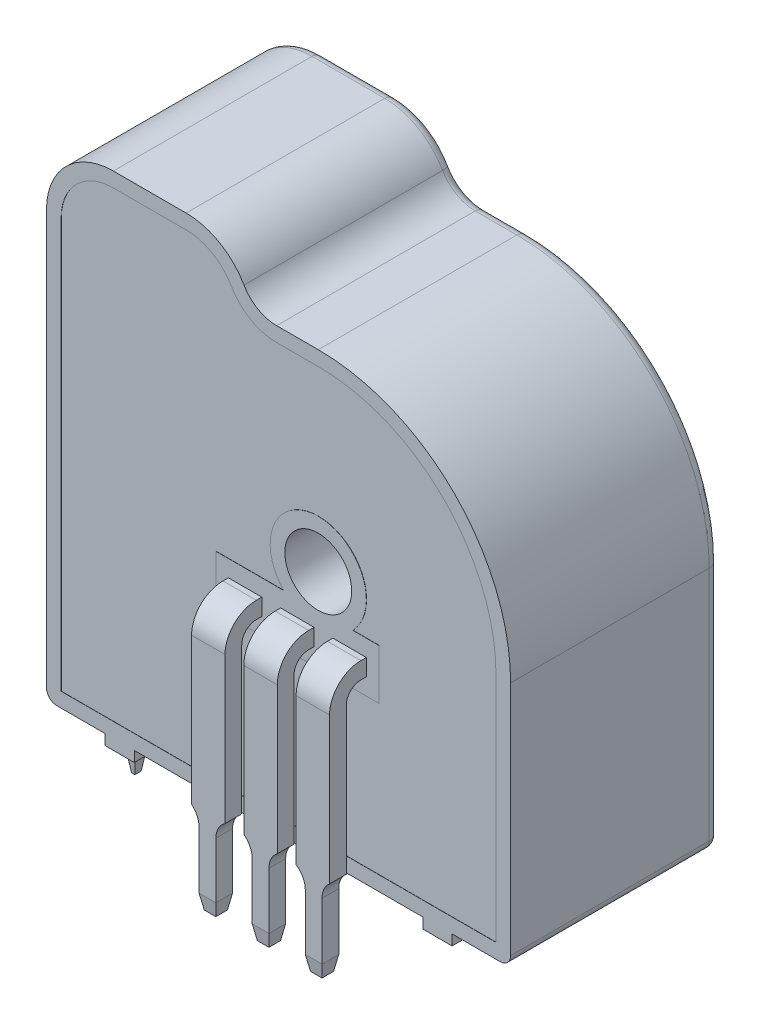
from build123d import *

# Parameters (mm, degrees)
SKETCH1_R                      = 1.6
BOSS_EXTRUDE1_DEPTH            = 10
FILLET1_R                      = 9.2
FILLET2_R                      = 3.2
FILLET3_R                      = 1.8
FILLET4_R                      = 0.5
CUT_EXTRUDE1_DEPTH             = 0.01
BOSS_EXTRUDE2_DEPTH            = 0.26
BOSS_EXTRUDE2_DEPTH_BACK       = 10.24
SKETCH8_W                      = 1.6
SKETCH8_H                      = 0.8
SKETCH9_W                      = 1.6
SKETCH9_H                      = 0.8
SKETCH12_W                     = 1.6
SKETCH12_H                     = 0.8
BOSS_EXTRUDE3_DEPTH            = 7
SKETCH13_W                     = 1.6
SKETCH13_H                     = 0.8
SKETCH16_W                     = 1.6
SKETCH16_H                     = 0.8
BOSS_EXTRUDE5_DEPTH            = 7
SKETCH17_W                     = 0.8
SKETCH17_H                     = 0.8
BOSS_EXTRUDE6_DEPTH            = 3.5
SKETCH18_W                     = 0.8
SKETCH18_H                     = 0.8
BOSS_EXTRUDE7_DEPTH            = 0.7
BOSS_EXTRUDE7_DRAFT            = 10
BOSS_EXTRUDE7_PROFILE_2_DEPTH  = 0.7
BOSS_EXTRUDE7_PROFILE_2_DRAFT  = 10
BOSS_EXTRUDE7_PROFILE_3_DEPTH  = 0.7
BOSS_EXTRUDE7_PROFILE_3_DRAFT  = 10
BOSS_EXTRUDE7_PROFILE_4_DEPTH  = 0.7
BOSS_EXTRUDE7_PROFILE_4_DRAFT  = 10
BOSS_EXTRUDE7_PROFILE_5_DEPTH  = 0.7
BOSS_EXTRUDE7_PROFILE_5_DRAFT  = 10
BOSS_EXTRUDE7_PROFILE_6_DEPTH  = 0.7
BOSS_EXTRUDE7_PROFILE_6_DRAFT  = 10
FILLET5_R                      = 1
SKETCH22_W                     = 1.4
SKETCH22_H                     = 9.5
BOSS_EXTRUDE8_DEPTH            = 0.5
SKETCH23_W                     = 0.35
SKETCH23_H                     = 0.5
BOSS_EXTRUDE9_DEPTH            = 2.6
SKETCH24_W                     = 0.35
SKETCH24_H                     = 0.5
BOSS_EXTRUDE10_DEPTH           = 0.7
BOSS_EXTRUDE10_DRAFT           = 8
BOSS_EXTRUDE10_PROFILE_2_DEPTH = 0.7
BOSS_EXTRUDE10_PROFILE_2_DRAFT = 8
BOSS_EXTRUDE10_PROFILE_3_DEPTH = 0.7
BOSS_EXTRUDE10_PROFILE_3_DRAFT = 8
BOSS_EXTRUDE11_DEPTH           = 0.05
CUT_EXTRUDE2_DEPTH             = 0.1
CUT_EXTRUDE3_DEPTH             = 0.1


with BuildPart() as part:
    # Sketch1 → Boss-Extrude1 (new body)
    with BuildSketch(Plane.XY):
        Polygon((0, 0), (22.2, 0), (22.2, 21), (9.8, 21), (9.8, 23.5), (0, 23.5), align=None)
        with Locations((13, 11.8)):
            Circle(SKETCH1_R, mode=Mode.SUBTRACT)
    extrude(amount=BOSS_EXTRUDE1_DEPTH)

    # Fillet1
    fillet1_edges = [part.edges().sort_by_distance(p)[0] for p in [
        (22.2, 21, 5),
    ]]
    fillet(fillet1_edges, radius=FILLET1_R)

    # Fillet2
    # the kernel refuses this fillet: 3.2 mm, written as the material it takes off along each edge
    with BuildSketch(Plane(origin=(9.8, 23.5, -7.806247498), x_dir=(0, -1, 0), z_dir=(0, 0, 1))) as fillet2_piece_1:
        with BuildLine():
            CenterArc((3.2, -3.122498999), FILLET2_R, 102.635625093, 77.364374907)
            Line((0, -3.122498999), (-0.064, -3.122498999))
            Line((-0.064, -3.122498999), (-0.064, 0))
            Line((-0.064, 0), (0, 0.064))
            ThreePointArc((0, 0.064), (1.25, 0.064), (2.486, 0.06244998))
            Line((2.486, 0.06244998), (2.5, 0))
        make_face()
    extrude(amount=25.612494996, mode=Mode.SUBTRACT)
    with BuildSketch(Plane(origin=(0, 23.5, -8), x_dir=(0, -1, 0), z_dir=(0, 0, 1))) as fillet2_piece_2:
        with BuildLine():
            CenterArc((FILLET2_R, FILLET2_R), FILLET2_R, 180, 90)
            Line((0, FILLET2_R), (-FILLET2_R * 0.02, FILLET2_R))
            Line((-FILLET2_R * 0.02, FILLET2_R), (-FILLET2_R * 0.02, -FILLET2_R * 0.02))
            Line((-FILLET2_R * 0.02, -FILLET2_R * 0.02), (FILLET2_R, -FILLET2_R * 0.02))
            Line((FILLET2_R, -FILLET2_R * 0.02), (FILLET2_R, 0))
        make_face()
    extrude(amount=26, mode=Mode.SUBTRACT)

    # Fillet3
    fillet3_edges = [part.edges().sort_by_distance(p)[0] for p in [
        (9.8, 21, 5),
    ]]
    fillet(fillet3_edges, radius=FILLET3_R)

    # Fillet4
    fillet4_edges = [part.edges().sort_by_distance(p)[0] for p in [
        (22.2, 0, 5),
        (0, 0, 5),
        (12.00381401, 21, 0),
        (19.505382387, 18.305382387, 0),
        (4.9387505, 23.5, 0),
        (0, 10.15, 0),
        (0.9372583, 22.5627417, 0),
        (8.277501001, 23.071281292, 0),
        (10.10762802, 21.241154273, 0),
        (22.2, 5.9, 0),
        (11.1, 0, 0),
    ]]
    fillet(fillet4_edges, radius=FILLET4_R)

    # Sketch4 → Cut-Extrude1 (cut)
    with BuildSketch(Plane.XY.offset(10)):
        with BuildLine():
            Line((0.7, 0.7), (21.5, 0.7))
            Line((21.5, 0.7), (21.5, 11.8))
            ThreePointArc((21.5, 11.8), (19.01040764, 17.81040764), (13, 20.3))
            Line((13, 20.3), (11.00762802, 20.3))
            ThreePointArc((11.00762802, 20.3), (9.75762802, 20.634936491), (8.84256451, 21.55))
            ThreePointArc((8.84256451, 21.55), (7.927501001, 22.465063509), (6.677501001, 22.8))
            Line((6.677501001, 22.8), (3.2, 22.8))
            ThreePointArc((3.2, 22.8), (1.432233047, 22.067766953), (0.7, 20.3))
            Line((0.7, 20.3), (0.7, 0.7))
        make_face()
        with BuildLine():
            Line((8.1, 7.8), (15.9, 7.8))
            Line((15.9, 7.8), (15.9, 10.2))
            Line((15.9, 10.2), (14.652271164, 10.2))
            ThreePointArc((14.652271164, 10.2), (13, 14.1), (11.347728836, 10.2))
            Line((11.347728836, 10.2), (8.1, 10.2))
            Line((8.1, 10.2), (8.1, 7.8))
        make_face(mode=Mode.SUBTRACT)
    extrude(amount=-CUT_EXTRUDE1_DEPTH, mode=Mode.SUBTRACT)

    # Sketch8 → Boss-Extrude2 (add, two sides: drawn at the far end of the back side and taken through both)
    with BuildSketch(Plane.XY.offset(10).offset(-BOSS_EXTRUDE2_DEPTH_BACK)):
        with Locations((9.5, 9)):
            Rectangle(SKETCH8_W, SKETCH8_H)
        with Locations((12, 9)):
            Rectangle(SKETCH8_W, SKETCH8_H)
        with Locations((14.5, 9)):
            Rectangle(SKETCH8_W, SKETCH8_H)
    extrude(amount=BOSS_EXTRUDE2_DEPTH + BOSS_EXTRUDE2_DEPTH_BACK)

    # Sweep4: sweep along a path in Sketch11
    with BuildLine(Plane(origin=(12, 0, 0), x_dir=(0, 0, -1), z_dir=(1, 0, 0))) as sweep4_path:
        ThreePointArc((-10.26, 9), (-11.037817459, 8.677817459), (-11.36, 7.9))
    # Sketch9 → Sweep4 (sweep)
    with BuildSketch(Plane.XY.offset(10.26)):
        with Locations((12, 9)):
            Rectangle(SKETCH9_W, SKETCH9_H)
        with Locations((14.5, 9)):
            Rectangle(SKETCH9_W, SKETCH9_H)
        with Locations((9.5, 9)):
            Rectangle(SKETCH9_W, SKETCH9_H)
    sweep(path=sweep4_path.line)

    # Sketch12 → Boss-Extrude3 (add)
    with BuildSketch(Plane.XZ.offset(-7.9)):
        with Locations((12, 11.36)):
            Rectangle(SKETCH12_W, SKETCH12_H)
        with Locations((14.5, 11.36)):
            Rectangle(SKETCH12_W, SKETCH12_H)
        with Locations((9.5, 11.36)):
            Rectangle(SKETCH12_W, SKETCH12_H)
    extrude(amount=BOSS_EXTRUDE3_DEPTH)

    # Sweep5: sweep along a path in Sketch14
    with BuildLine(Plane(origin=(12, 0, 0), x_dir=(0, 0, -1), z_dir=(1, 0, 0))) as sweep5_path:
        ThreePointArc((0.24, 9), (1.017817459, 8.677817459), (1.34, 7.9))
    # Sketch13 → Sweep5 (sweep)
    with BuildSketch(Plane(origin=(0, 0, -0.24), x_dir=(-1, 0, 0), z_dir=(0, 0, -1))):
        with Locations((-14.5, 9)):
            Rectangle(SKETCH13_W, SKETCH13_H)
        with Locations((-9.5, 9)):
            Rectangle(SKETCH13_W, SKETCH13_H)
        with Locations((-12, 9)):
            Rectangle(SKETCH13_W, SKETCH13_H)
    sweep(path=sweep5_path.line)

    # Sketch16 → Boss-Extrude5 (add)
    with BuildSketch(Plane.XZ.offset(-7.9)):
        with Locations((12, -1.34)):
            Rectangle(SKETCH16_W, SKETCH16_H)
        with Locations((14.5, -1.34)):
            Rectangle(SKETCH16_W, SKETCH16_H)
        with Locations((9.5, -1.34)):
            Rectangle(SKETCH16_W, SKETCH16_H)
    extrude(amount=BOSS_EXTRUDE5_DEPTH)

    # Sketch17 → Boss-Extrude6 (add)
    with BuildSketch(Plane.XZ.offset(-0.9)):
        with Locations((12, -1.34)):
            Rectangle(SKETCH17_W, SKETCH17_H)
        with Locations((14.54, -1.34)):
            Rectangle(SKETCH17_W, SKETCH17_H)
        with Locations((9.46, -1.34)):
            Rectangle(SKETCH17_W, SKETCH17_H)
        with Locations((14.54, 11.36)):
            Rectangle(SKETCH17_W, SKETCH17_H)
        with Locations((12, 11.36)):
            Rectangle(SKETCH17_W, SKETCH17_H)
        with Locations((9.46, 11.36)):
            Rectangle(SKETCH17_W, SKETCH17_H)
    extrude(amount=BOSS_EXTRUDE6_DEPTH)


with BuildPart() as boss_extrude7_tool:
    # Sketch18 → Boss-Extrude7 (with draft: the straight prism first)
    with BuildSketch(Plane.XZ.offset(2.6)):
        with Locations((12, 11.36)):
            Rectangle(SKETCH18_W, SKETCH18_H)
    extrude(amount=BOSS_EXTRUDE7_DEPTH)
    # Boss-Extrude7: the draft: its side faces are tilted about the plane it starts from
    boss_extrude7_sides = [boss_extrude7_tool.faces().sort_by_distance(p)[0] for p in [
        (12, -2.95, 11.76),
        (11.6, -2.95, 11.36),
        (12, -2.95, 10.96),
        (12.4, -2.95, 11.36),
    ]]
    draft(boss_extrude7_sides, Plane.XZ.offset(2.6), BOSS_EXTRUDE7_DRAFT)


with BuildPart() as part_1:
    add(part.part)

    # Boss-Extrude7: add boss_extrude7_tool
    add(boss_extrude7_tool.part)


with BuildPart() as boss_extrude7_profile_2_tool:
    # Sketch18 → Boss-Extrude7 profile 2 (with draft: the straight prism first)
    with BuildSketch(Plane.XZ.offset(2.6)):
        with Locations((14.54, 11.36)):
            Rectangle(SKETCH18_W, SKETCH18_H)
    extrude(amount=BOSS_EXTRUDE7_PROFILE_2_DEPTH)
    # Boss-Extrude7 profile 2: the draft: its side faces are tilted about the plane it starts from
    boss_extrude7_profile_2_sides = [boss_extrude7_profile_2_tool.faces().sort_by_distance(p)[0] for p in [
        (14.54, -2.95, 10.96),
        (14.94, -2.95, 11.36),
        (14.54, -2.95, 11.76),
        (14.14, -2.95, 11.36),
    ]]
    draft(boss_extrude7_profile_2_sides, Plane.XZ.offset(2.6), BOSS_EXTRUDE7_PROFILE_2_DRAFT)


with BuildPart() as part_2:
    add(part_1.part)

    # Boss-Extrude7 profile 2: add boss_extrude7_profile_2_tool
    add(boss_extrude7_profile_2_tool.part)


with BuildPart() as boss_extrude7_profile_3_tool:
    # Sketch18 → Boss-Extrude7 profile 3 (with draft: the straight prism first)
    with BuildSketch(Plane.XZ.offset(2.6)):
        with Locations((9.46, 11.36)):
            Rectangle(SKETCH18_W, SKETCH18_H)
    extrude(amount=BOSS_EXTRUDE7_PROFILE_3_DEPTH)
    # Boss-Extrude7 profile 3: the draft: its side faces are tilted about the plane it starts from
    boss_extrude7_profile_3_sides = [boss_extrude7_profile_3_tool.faces().sort_by_distance(p)[0] for p in [
        (9.46, -2.95, 10.96),
        (9.86, -2.95, 11.36),
        (9.46, -2.95, 11.76),
        (9.06, -2.95, 11.36),
    ]]
    draft(boss_extrude7_profile_3_sides, Plane.XZ.offset(2.6), BOSS_EXTRUDE7_PROFILE_3_DRAFT)


with BuildPart() as part_3:
    add(part_2.part)

    # Boss-Extrude7 profile 3: add boss_extrude7_profile_3_tool
    add(boss_extrude7_profile_3_tool.part)


with BuildPart() as boss_extrude7_profile_4_tool:
    # Sketch18 → Boss-Extrude7 profile 4 (with draft: the straight prism first)
    with BuildSketch(Plane.XZ.offset(2.6)):
        with Locations((14.54, -1.34)):
            Rectangle(SKETCH18_W, SKETCH18_H)
    extrude(amount=BOSS_EXTRUDE7_PROFILE_4_DEPTH)
    # Boss-Extrude7 profile 4: the draft: its side faces are tilted about the plane it starts from
    boss_extrude7_profile_4_sides = [boss_extrude7_profile_4_tool.faces().sort_by_distance(p)[0] for p in [
        (14.54, -2.95, -1.74),
        (14.94, -2.95, -1.34),
        (14.54, -2.95, -0.94),
        (14.14, -2.95, -1.34),
    ]]
    draft(boss_extrude7_profile_4_sides, Plane.XZ.offset(2.6), BOSS_EXTRUDE7_PROFILE_4_DRAFT)


with BuildPart() as part_4:
    add(part_3.part)

    # Boss-Extrude7 profile 4: add boss_extrude7_profile_4_tool
    add(boss_extrude7_profile_4_tool.part)


with BuildPart() as boss_extrude7_profile_5_tool:
    # Sketch18 → Boss-Extrude7 profile 5 (with draft: the straight prism first)
    with BuildSketch(Plane.XZ.offset(2.6)):
        with Locations((12, -1.34)):
            Rectangle(SKETCH18_W, SKETCH18_H)
    extrude(amount=BOSS_EXTRUDE7_PROFILE_5_DEPTH)
    # Boss-Extrude7 profile 5: the draft: its side faces are tilted about the plane it starts from
    boss_extrude7_profile_5_sides = [boss_extrude7_profile_5_tool.faces().sort_by_distance(p)[0] for p in [
        (12, -2.95, -0.94),
        (11.6, -2.95, -1.34),
        (12, -2.95, -1.74),
        (12.4, -2.95, -1.34),
    ]]
    draft(boss_extrude7_profile_5_sides, Plane.XZ.offset(2.6), BOSS_EXTRUDE7_PROFILE_5_DRAFT)


with BuildPart() as part_5:
    add(part_4.part)

    # Boss-Extrude7 profile 5: add boss_extrude7_profile_5_tool
    add(boss_extrude7_profile_5_tool.part)


with BuildPart() as boss_extrude7_profile_6_tool:
    # Sketch18 → Boss-Extrude7 profile 6 (with draft: the straight prism first)
    with BuildSketch(Plane.XZ.offset(2.6)):
        with Locations((9.46, -1.34)):
            Rectangle(SKETCH18_W, SKETCH18_H)
    extrude(amount=BOSS_EXTRUDE7_PROFILE_6_DEPTH)
    # Boss-Extrude7 profile 6: the draft: its side faces are tilted about the plane it starts from
    boss_extrude7_profile_6_sides = [boss_extrude7_profile_6_tool.faces().sort_by_distance(p)[0] for p in [
        (9.46, -2.95, -0.94),
        (9.06, -2.95, -1.34),
        (9.46, -2.95, -1.74),
        (9.86, -2.95, -1.34),
    ]]
    draft(boss_extrude7_profile_6_sides, Plane.XZ.offset(2.6), BOSS_EXTRUDE7_PROFILE_6_DRAFT)


with BuildPart() as part_6:
    add(part_5.part)

    # Boss-Extrude7 profile 6: add boss_extrude7_profile_6_tool
    add(boss_extrude7_profile_6_tool.part)

    # Fillet5
    # the kernel refuses this fillet: 1 mm, written as the material it adds along each edge
    with BuildSketch(Plane(origin=(9.06, 0.9, -1.74), x_dir=(-1, 0, 0), z_dir=(0, 0, 1)), Plane(origin=(9.06, 0.9, 10.96), x_dir=(-1, 0, 0), z_dir=(0, 0, 1))) as fillet5_piece_1:
        with BuildLine():
            CenterArc((1, 0.768374908), FILLET5_R, 180, 50.2081805)
            Line((0, 0.768374908), (0, 0))
            Line((0, 0), (0.36, 0))
        make_face()
    extrude(amount=0.8)
    with BuildSketch(Plane(origin=(9.86, 0.9, -0.94), x_dir=(1.0, -2.749568249844972e-12, 0), z_dir=(0, 0, -1)), Plane(origin=(9.86, 0.9, 11.76), x_dir=(1.0, -2.7478019859421624e-12, 0), z_dir=(0, 0, -1))) as fillet5_piece_2:
        with BuildLine():
            CenterArc((1, 0.828492607), FILLET5_R, 180, 55.944202257)
            Line((0, 0.828492607), (0, 0))
            Line((0, 0), (0.44, 0))
        make_face()
    extrude(amount=0.8)
    with BuildSketch(Plane(origin=(11.6, 0.9, -1.74), x_dir=(-1, 0, 0), z_dir=(0, 0, 1)), Plane(origin=(12.4, 0.9, -0.94), x_dir=(1, 0, 0), z_dir=(0, 0, -1)), Plane(origin=(12.4, 0.9, 11.76), x_dir=(1, 0, 0), z_dir=(0, 0, -1)), Plane(origin=(11.6, 0.9, 10.96), x_dir=(-1, 0, 0), z_dir=(0, 0, 1))) as fillet5_piece_3:
        with BuildLine():
            CenterArc((1, 0.8), FILLET5_R, 180, 53.130102354)
            Line((0, 0.8), (0, 0))
            Line((0, 0), (0.4, 0))
        make_face()
    extrude(amount=0.8)
    with BuildSketch(Plane(origin=(14.14, 0.9, -0.94), x_dir=(-1.0, -2.749568249844961e-12, 0), z_dir=(0, 0, -1)), Plane(origin=(14.14, 0.9, 11.76), x_dir=(-1.0, -2.7478019859421624e-12, 0), z_dir=(0, 0, -1))) as fillet5_piece_4:
        with BuildLine():
            CenterArc((1, -0.828492607), FILLET5_R, 124.055797743, 55.944202257)
            Line((0, -0.828492607), (0, 0))
            Line((0, 0), (0.44, 0))
        make_face()
    extrude(amount=0.8)
    with BuildSketch(Plane(origin=(14.94, 0.9, -1.74), x_dir=(1, 0, 0), z_dir=(0, 0, 1)), Plane(origin=(14.94, 0.9, 10.96), x_dir=(1, 0, 0), z_dir=(0, 0, 1))) as fillet5_piece_5:
        with BuildLine():
            CenterArc((1, -0.768374908), FILLET5_R, 129.7918195, 50.2081805)
            Line((0, -0.768374908), (0, 0))
            Line((0, 0), (0.36, 0))
        make_face()
    extrude(amount=0.8)

    # Sketch22 → Boss-Extrude8 (add)
    with BuildSketch(Plane.XZ):
        with Locations((3.5, 5.25)):
            Rectangle(SKETCH22_W, SKETCH22_H)
        with Locations((18.7, 5.25)):
            Rectangle(SKETCH22_W, SKETCH22_H)
    extrude(amount=BOSS_EXTRUDE8_DEPTH)

    # Sketch23 → Boss-Extrude9 (add)
    with BuildSketch(Plane.XZ):
        with Locations((1.84, 5)):
            Rectangle(SKETCH23_W, SKETCH23_H)
        with Locations((1.84, 7.54)):
            Rectangle(SKETCH23_W, SKETCH23_H)
        with Locations((1.84, 2.46)):
            Rectangle(SKETCH23_W, SKETCH23_H)
    extrude(amount=BOSS_EXTRUDE9_DEPTH)


with BuildPart() as boss_extrude10_tool:
    # Sketch24 → Boss-Extrude10 (with draft: the straight prism first)
    with BuildSketch(Plane.XZ.offset(2.6)):
        with Locations((1.84, 5)):
            Rectangle(SKETCH24_W, SKETCH24_H)
    extrude(amount=BOSS_EXTRUDE10_DEPTH)
    # Boss-Extrude10: the draft: its side faces are tilted about the plane it starts from
    boss_extrude10_sides = [boss_extrude10_tool.faces().sort_by_distance(p)[0] for p in [
        (1.665, -2.95, 5),
        (1.84, -2.95, 4.75),
        (2.015, -2.95, 5),
        (1.84, -2.95, 5.25),
    ]]
    draft(boss_extrude10_sides, Plane.XZ.offset(2.6), BOSS_EXTRUDE10_DRAFT)


with BuildPart() as part_7:
    add(part_6.part)

    # Boss-Extrude10: add boss_extrude10_tool
    add(boss_extrude10_tool.part)


with BuildPart() as boss_extrude10_profile_2_tool:
    # Sketch24 → Boss-Extrude10 profile 2 (with draft: the straight prism first)
    with BuildSketch(Plane.XZ.offset(2.6)):
        with Locations((1.84, 7.54)):
            Rectangle(SKETCH24_W, SKETCH24_H)
    extrude(amount=BOSS_EXTRUDE10_PROFILE_2_DEPTH)
    # Boss-Extrude10 profile 2: the draft: its side faces are tilted about the plane it starts from
    boss_extrude10_profile_2_sides = [boss_extrude10_profile_2_tool.faces().sort_by_distance(p)[0] for p in [
        (1.665, -2.95, 7.54),
        (1.84, -2.95, 7.29),
        (2.015, -2.95, 7.54),
        (1.84, -2.95, 7.79),
    ]]
    draft(boss_extrude10_profile_2_sides, Plane.XZ.offset(2.6), BOSS_EXTRUDE10_PROFILE_2_DRAFT)


with BuildPart() as part_8:
    add(part_7.part)

    # Boss-Extrude10 profile 2: add boss_extrude10_profile_2_tool
    add(boss_extrude10_profile_2_tool.part)


with BuildPart() as boss_extrude10_profile_3_tool:
    # Sketch24 → Boss-Extrude10 profile 3 (with draft: the straight prism first)
    with BuildSketch(Plane.XZ.offset(2.6)):
        with Locations((1.84, 2.46)):
            Rectangle(SKETCH24_W, SKETCH24_H)
    extrude(amount=BOSS_EXTRUDE10_PROFILE_3_DEPTH)
    # Boss-Extrude10 profile 3: the draft: its side faces are tilted about the plane it starts from
    boss_extrude10_profile_3_sides = [boss_extrude10_profile_3_tool.faces().sort_by_distance(p)[0] for p in [
        (1.665, -2.95, 2.46),
        (1.84, -2.95, 2.21),
        (2.015, -2.95, 2.46),
        (1.84, -2.95, 2.71),
    ]]
    draft(boss_extrude10_profile_3_sides, Plane.XZ.offset(2.6), BOSS_EXTRUDE10_PROFILE_3_DRAFT)


with BuildPart() as part_9:
    add(part_8.part)

    # Boss-Extrude10 profile 3: add boss_extrude10_profile_3_tool
    add(boss_extrude10_profile_3_tool.part)

    # Sketch25 → Boss-Extrude11 (add)
    # profile 1 of 6: a face of its own
    with BuildSketch(Plane.ZY):
        Polygon((2.034729358, 7.695462819), (6.674153315, 7.695462819), (6.674153315, 8.655708572), (8.584799258, 6.745062628), (6.674153315, 4.834416685), (6.674153315, 5.794662438), (2.034729358, 5.794662438), (2.034729358, 6.745062628), align=None)
    # profile 2 of 6: a face of its own
    with BuildSketch(Plane.ZY):
        Polygon((2.143076923, 1.470277962), (1.553333333, 1.470277962), (1.553333333, 1.649765142), (2.143076923, 1.649765142), (2.143076923, 2.239508731), (2.322564103, 2.239508731), (2.322564103, 1.649765142), (2.912307692, 1.649765142), (2.912307692, 1.470277962), (2.322564103, 1.470277962), (2.322564103, 0.880534372), (2.143076923, 0.880534372), align=None)
    # profile 3 of 6: a face of its own
    with BuildSketch(Plane.ZY):
        with BuildLine():
            add(Edge.make_bspline(
                [(4.960641026, 0.939135081), (4.934996506, 0.939285032), (4.885181656, 0.939576315), (4.812594391, 0.942816736), (4.744498258, 0.948199749), (4.68089, 0.955576834), (4.621753192, 0.964554196), (4.567245878, 0.976538421), (4.51711576, 0.99016712), (4.471199437, 1.005962562), (4.428878057, 1.023785417), (4.389369903, 1.043184411), (4.352731784, 1.064926634), (4.31838954, 1.087779239), (4.286867673, 1.112631876), (4.257802993, 1.138951656), (4.231440607, 1.167264979), (4.207762461, 1.197297232), (4.187000183, 1.228844871), (4.16859943, 1.261045819), (4.153442827, 1.294475434), (4.14104431, 1.328693634), (4.130923113, 1.363772538), (4.123970888, 1.399703191), (4.119604338, 1.436568883), (4.119186344, 1.461451679), (4.118974359, 1.474070979)],
                knots=[0, 0, 0, 0, 1.646148282, 3.197666765, 4.66315463, 6.030252048, 7.307778049, 8.501004361, 9.610818041, 10.641065266, 11.615491391, 12.557119604, 13.464013759, 14.348536654, 15.203310953, 16.038349431, 16.863300206, 17.683791446, 18.490318933, 19.285717724, 20.06220424, 20.843281102, 21.620494212, 22.403315558, 23.190242141, 24, 24, 24, 24], degree=3))
            add(Edge.make_bspline(
                [(4.118974359, 1.474070979), (4.11915093, 1.48680194), (4.119502245, 1.512132072), (4.124447214, 1.549446425), (4.130829828, 1.586110827), (4.14106649, 1.621569004), (4.153315983, 1.656491403), (4.169478995, 1.690009575), (4.187057526, 1.723306888), (4.208501855, 1.754870689), (4.232201368, 1.785644048), (4.259106373, 1.814490858), (4.288472272, 1.842148523), (4.320954011, 1.867572422), (4.356053548, 1.891852188), (4.394065119, 1.914066137), (4.434904483, 1.93467628), (4.478382317, 1.95407003), (4.52565998, 1.971029353), (4.57644259, 1.986107547), (4.631190007, 1.998466678), (4.689597253, 2.008687462), (4.751953678, 2.016620737), (4.818132939, 2.022394439), (4.88817644, 2.025445339), (4.936065757, 2.026019782), (4.960641026, 2.026314568)],
                knots=[0, 0, 0, 0, 0.810910589, 1.61342667, 2.396193133, 3.181089899, 3.963115317, 4.752255436, 5.550715454, 6.36105385, 7.181178335, 8.024612154, 8.872680183, 9.750181803, 10.651284446, 11.591556747, 12.554036451, 13.566402641, 14.62422919, 15.753422176, 16.94128843, 18.199818041, 19.531985927, 20.947085226, 22.433341622, 24, 24, 24, 24], degree=3))
            add(Edge.make_bspline(
                [(4.960641026, 2.026314568), (4.985108884, 2.026013297), (5.032890224, 2.025424968), (5.102621849, 2.022459873), (5.168444389, 2.016479712), (5.230428023, 2.009108411), (5.288601488, 1.99877339), (5.342926878, 1.986320544), (5.393596531, 1.972132379), (5.440247404, 1.954912776), (5.48364979, 1.93597043), (5.524188866, 1.915382404), (5.562190398, 1.893293812), (5.597382515, 1.869378186), (5.629733878, 1.843536089), (5.659200497, 1.815897811), (5.68627663, 1.786799134), (5.71023724, 1.755846372), (5.731844836, 1.723988573), (5.750061281, 1.690687877), (5.765844763, 1.65679654), (5.778749215, 1.621976187), (5.788756768, 1.586280579), (5.795636416, 1.549591048), (5.80047228, 1.512126806), (5.800840549, 1.486800178), (5.801025641, 1.474070979)],
                knots=[0, 0, 0, 0, 1.561645053, 3.049612875, 4.452756685, 5.778837748, 7.032101753, 8.221335837, 9.334924186, 10.387562255, 11.392109817, 12.355697819, 13.287721948, 14.19548756, 15.068665045, 15.927346723, 16.771751757, 17.602390507, 18.423119567, 19.225778204, 20.022010933, 20.807278863, 21.593079439, 22.384715467, 23.188155646, 24, 24, 24, 24], degree=3))
            add(Edge.make_bspline(
                [(5.801025641, 1.474070979), (5.80081245, 1.461451955), (5.800392079, 1.436569704), (5.796042944, 1.399700023), (5.789050714, 1.363913764), (5.779260268, 1.329034332), (5.767276339, 1.294882788), (5.75166324, 1.261924465), (5.733681899, 1.22979303), (5.713204192, 1.198573736), (5.689742086, 1.168855025), (5.663795613, 1.140462773), (5.634699417, 1.114136503), (5.602911587, 1.089499361), (5.568518248, 1.066405162), (5.531496318, 1.044850821), (5.491782582, 1.025045015), (5.449126732, 1.00691766), (5.402884515, 0.990845738), (5.352626611, 0.976704015), (5.297842547, 0.965409455), (5.238810475, 0.95583557), (5.175410444, 0.94816389), (5.107619518, 0.942818971), (5.035566426, 0.939578775), (4.986071913, 0.939285678), (4.960641026, 0.939135081)],
                knots=[0, 0, 0, 0, 0.810927267, 1.598990287, 2.382942141, 3.152806972, 3.926217614, 4.706701772, 5.493896336, 6.292070767, 7.104102563, 7.925577746, 8.761822141, 9.623241997, 10.509042271, 11.423174113, 12.375371989, 13.360203808, 14.400680605, 15.520553799, 16.714061498, 17.994519714, 19.364400916, 20.818312473, 22.365209998, 24, 24, 24, 24], degree=3))
        make_face()
        with BuildLine():
            add(Edge.make_bspline(
                [(4.96, 1.082724825), (4.981370748, 1.082780626), (5.022847174, 1.082888927), (5.083013037, 1.085636313), (5.139224023, 1.089460394), (5.191458195, 1.094271309), (5.239532996, 1.101476338), (5.28364829, 1.109650884), (5.32372242, 1.119455752), (5.360105587, 1.131113875), (5.393312991, 1.144393611), (5.424229728, 1.158867292), (5.453222217, 1.174553922), (5.48022012, 1.191775044), (5.504893416, 1.21087113), (5.527867516, 1.230956885), (5.548343403, 1.25293716), (5.572905124, 1.283337519), (5.598284887, 1.323473688), (5.620386081, 1.374042846), (5.634275173, 1.426005615), (5.636041466, 1.461274752), (5.636923077, 1.478878671)],
                knots=[0, 0, 0, 0, 1.459098681, 2.831824031, 4.11146945, 5.306290378, 6.412266529, 7.42953815, 8.369053297, 9.227277979, 10.03601793, 10.809473603, 11.557037441, 12.285528272, 12.993193355, 13.685654407, 14.36688038, 15.041354379, 16.352855396, 17.594313975, 18.799247529, 20, 20, 20, 20], degree=3))
            add(Edge.make_bspline(
                [(5.636923077, 1.478878671), (5.636151121, 1.496584493), (5.634609947, 1.53193333), (5.621159189, 1.583848365), (5.599292527, 1.633830759), (5.574310385, 1.673276334), (5.550366754, 1.703202551), (5.529976043, 1.724652103), (5.507137809, 1.744337115), (5.482498483, 1.763007915), (5.455585249, 1.780132026), (5.4265281, 1.795703757), (5.395246182, 1.809913284), (5.373408588, 1.818008849), (5.36224359, 1.822147902)],
                knots=[0, 0, 0, 0, 1.353621445, 2.702441307, 4.075953605, 5.516772412, 6.261413105, 7.007624062, 7.778524365, 8.566925914, 9.372323995, 10.217594641, 11.088702136, 12, 12, 12, 12], degree=3))
            add(Edge.make_bspline(
                [(5.36224359, 1.822147902), (5.347967137, 1.826971567), (5.318979817, 1.836765676), (5.274013576, 1.849388201), (5.226835169, 1.859328955), (5.177726545, 1.868272208), (5.126325538, 1.874376462), (5.072791191, 1.879289749), (5.01708314, 1.882183777), (4.979234001, 1.88254252), (4.96, 1.882724825)],
                knots=[0, 0, 0, 0, 0.884706709, 1.796334032, 2.740027952, 3.714592787, 4.726048262, 5.777819803, 6.87074269, 8, 8, 8, 8], degree=3))
            add(Edge.make_bspline(
                [(4.96, 1.882724825), (4.94076911, 1.88247331), (4.903149377, 1.881981292), (4.848055352, 1.880100612), (4.795727232, 1.875244121), (4.745939588, 1.869850238), (4.69896802, 1.861897224), (4.654419313, 1.853322223), (4.612845346, 1.841801681), (4.573595296, 1.829495454), (4.537114841, 1.815410854), (4.503234792, 1.799905995), (4.471788463, 1.783349307), (4.442873015, 1.765357886), (4.416320725, 1.746182334), (4.392742561, 1.725135124), (4.370991573, 1.70355291), (4.34660711, 1.672858452), (4.321548049, 1.633000764), (4.2991145, 1.583062224), (4.285837721, 1.531377987), (4.283996525, 1.496365825), (4.283076923, 1.478878671)],
                knots=[0, 0, 0, 0, 1.313483664, 2.569454835, 3.763100662, 4.901599063, 5.988328865, 7.015709358, 7.99797933, 8.932480776, 9.824041341, 10.666387587, 11.475829342, 12.24921787, 12.990555181, 13.709176526, 14.405678811, 15.080244297, 16.38186033, 17.610124501, 18.806354173, 20, 20, 20, 20], degree=3))
            add(Edge.make_bspline(
                [(4.283076923, 1.478878671), (4.283998813, 1.461179712), (4.285844273, 1.425749551), (4.299053099, 1.373513375), (4.321482413, 1.323237469), (4.346558831, 1.283248346), (4.370898081, 1.252926774), (4.391613584, 1.231409875), (4.414038959, 1.211045559), (4.438931135, 1.192443963), (4.465833911, 1.175324958), (4.494451477, 1.159032095), (4.52542598, 1.144751966), (4.558607346, 1.131429596), (4.594992514, 1.119752028), (4.635211646, 1.110059191), (4.679432291, 1.101235009), (4.727858353, 1.094880159), (4.780103674, 1.089284292), (4.83645841, 1.085678294), (4.896830877, 1.082876341), (4.938521895, 1.082776342), (4.96, 1.082724825)],
                knots=[0, 0, 0, 0, 1.207546505, 2.417292871, 3.651582144, 4.952510111, 5.626719005, 6.30238548, 6.989136872, 7.692112372, 8.420316868, 9.164734959, 9.937886623, 10.746308695, 11.604196049, 12.543341915, 13.568754172, 14.680483261, 15.875568977, 17.154711427, 18.534182925, 20, 20, 20, 20], degree=3))
        make_face(mode=Mode.SUBTRACT)
    # profile 4 of 6: a face of its own
    with BuildSketch(Plane.ZY):
        with BuildLine():
            add(Edge.make_bspline(
                [(7.489110708, 2.074329832), (7.520336868, 2.073917039), (7.581408336, 2.073109707), (7.670629904, 2.066667926), (7.755057772, 2.055307006), (7.834630889, 2.040251719), (7.909071887, 2.021070118), (7.977608641, 1.996424109), (8.040858786, 1.968448272), (8.098072145, 1.935211476), (8.149611551, 1.897967004), (8.194662905, 1.855836909), (8.233561373, 1.809356445), (8.266109768, 1.758329285), (8.291539194, 1.702705246), (8.310334907, 1.642917108), (8.321253874, 1.578540616), (8.322560072, 1.534141627), (8.32323049, 1.511353425)],
                knots=[0, 0, 0, 0, 1.321802895, 2.585154356, 3.783992126, 4.926125916, 6.011928698, 7.034164512, 8.006148777, 8.935597532, 9.829949148, 10.692404759, 11.539685452, 12.389377765, 13.246493798, 14.12127169, 15.035724909, 16, 16, 16, 16], degree=3))
            add(Edge.make_bspline(
                [(8.32323049, 1.511353425), (8.322669853, 1.488929267), (8.321578749, 1.445287704), (8.311227277, 1.382280235), (8.294496927, 1.323885009), (8.27140518, 1.270082465), (8.240958232, 1.221425176), (8.205412544, 1.176651418), (8.162942869, 1.136898852), (8.114929855, 1.101180985), (8.060435379, 1.070230306), (8.000092201, 1.043511678), (7.933626137, 1.021008106), (7.861203711, 1.003131369), (7.782993243, 0.989084319), (7.699015063, 0.978961187), (7.609333091, 0.973341617), (7.547678512, 0.972436148), (7.515970962, 0.971970485)],
                knots=[0, 0, 0, 0, 0.977226451, 1.901863502, 2.775159917, 3.621059822, 4.445427106, 5.271059701, 6.107045567, 6.974440992, 7.874918687, 8.833828156, 9.848260645, 10.930831618, 12.083697187, 13.311388976, 14.617308429, 16, 16, 16, 16], degree=3))
            add(Edge.make_bspline(
                [(7.515970962, 0.971970485), (7.485470539, 0.972380687), (7.425848765, 0.973182544), (7.338440664, 0.979677625), (7.255364814, 0.991075499), (7.176527377, 1.005861419), (7.102959918, 1.025912951), (7.034530657, 1.049633581), (6.971972951, 1.078377103), (6.914875414, 1.111249738), (6.864255189, 1.149230487), (6.819339749, 1.191287407), (6.780763344, 1.237849587), (6.748390782, 1.28886553), (6.722792353, 1.344346264), (6.704730374, 1.404445449), (6.693582236, 1.468834466), (6.692306385, 1.513242815), (6.691651543, 1.536035821)],
                knots=[0, 0, 0, 0, 1.300624578, 2.542441645, 3.734800861, 4.875244876, 5.960436564, 6.983641713, 7.960252352, 8.892111684, 9.787844242, 10.65291384, 11.510425805, 12.35927857, 13.22273094, 14.107382955, 15.028596385, 16, 16, 16, 16], degree=3))
            add(Edge.make_bspline(
                [(6.691651543, 1.536035821), (6.692259047, 1.557969772), (6.693443574, 1.600737144), (6.703209625, 1.662731869), (6.720081138, 1.720193953), (6.743011312, 1.773508457), (6.772674217, 1.822299216), (6.808146755, 1.8670712), (6.84995131, 1.907275113), (6.898044523, 1.942916312), (6.951875333, 1.974606583), (7.011959538, 2.001235947), (7.07758088, 2.024256413), (7.149310886, 2.042418908), (7.226526396, 2.056926416), (7.309349415, 2.066840081), (7.397423245, 2.073088612), (7.458004674, 2.073908734), (7.489110708, 2.074329832)],
                knots=[0, 0, 0, 0, 0.966070049, 1.883667749, 2.755790153, 3.598565265, 4.433259633, 5.264132151, 6.108625186, 6.980747591, 7.895926475, 8.855058927, 9.871680917, 10.956472819, 12.11178533, 13.331051805, 14.629606574, 16, 16, 16, 16], degree=3))
        make_face()
        with BuildLine():
            add(Edge.make_bspline(
                [(7.503629764, 1.901916039), (7.481603811, 1.90174515), (7.438246579, 1.901408761), (7.374440257, 1.897622189), (7.312940321, 1.891812422), (7.253984953, 1.884157597), (7.198095916, 1.87327878), (7.145702272, 1.859723822), (7.097133411, 1.842585838), (7.052430158, 1.822413536), (7.011929078, 1.798992486), (6.976092932, 1.771660769), (6.944711623, 1.740890171), (6.918327873, 1.706107318), (6.897085462, 1.667346963), (6.882493997, 1.624106055), (6.873068358, 1.576732041), (6.872158939, 1.543706431), (6.87168784, 1.526598434)],
                knots=[0, 0, 0, 0, 1.276051305, 2.511857341, 3.701898929, 4.854941845, 5.954824865, 6.998868203, 7.987745643, 8.93517665, 9.836922735, 10.692210334, 11.539879321, 12.375519884, 13.213069612, 14.088798431, 15.009955362, 16, 16, 16, 16], degree=3))
            add(Edge.make_bspline(
                [(6.87168784, 1.526598434), (6.872294387, 1.509491347), (6.873465868, 1.476450789), (6.883067623, 1.428933704), (6.898944801, 1.38551494), (6.921923882, 1.346688673), (6.950181029, 1.312070949), (6.982941325, 1.281161139), (7.019284636, 1.252879453), (7.060320756, 1.228720892), (7.105153896, 1.207555792), (7.153794623, 1.190183186), (7.205667933, 1.174880232), (7.261022256, 1.164097773), (7.318857203, 1.155971669), (7.378293146, 1.149732979), (7.439213307, 1.14600214), (7.480273059, 1.145651148), (7.501088929, 1.145473208)],
                knots=[0, 0, 0, 0, 0.994926097, 1.921596144, 2.808426169, 3.673173973, 4.534301525, 5.400939616, 6.289696654, 7.208736561, 8.16635496, 9.171076436, 10.211870536, 11.31117138, 12.449454227, 13.610511025, 14.788611925, 16, 16, 16, 16], degree=3))
            add(Edge.make_bspline(
                [(7.501088929, 1.145473208), (7.52395916, 1.145687243), (7.568755866, 1.146106481), (7.634527447, 1.149241181), (7.697436633, 1.155325124), (7.757492718, 1.16248287), (7.81428299, 1.172934796), (7.867079258, 1.186564995), (7.915924943, 1.203330682), (7.960606963, 1.223182376), (8.001365922, 1.246274343), (8.037072967, 1.273592954), (8.067968305, 1.304550893), (8.094513564, 1.338760164), (8.115558061, 1.377526533), (8.130438432, 1.420913436), (8.139120724, 1.468901955), (8.140130252, 1.502363295), (8.140653358, 1.519701883)],
                knots=[0, 0, 0, 0, 1.311614995, 2.569105351, 3.774655983, 4.935691789, 6.036703288, 7.083532887, 8.060044221, 8.994967622, 9.884039276, 10.740338515, 11.56463633, 12.38624284, 13.215258456, 14.082064141, 15.0061875, 16, 16, 16, 16], degree=3))
            add(Edge.make_bspline(
                [(8.140653358, 1.519701883), (8.14004206, 1.537046871), (8.138865151, 1.570440549), (8.129384715, 1.61853472), (8.112942159, 1.662141864), (8.090100657, 1.701433217), (8.061772384, 1.736361146), (8.029072956, 1.76787763), (7.99195278, 1.79610071), (7.949775869, 1.819574386), (7.904453649, 1.840951342), (7.85514803, 1.857966481), (7.802770363, 1.872834568), (7.746921783, 1.883200315), (7.688768741, 1.891439169), (7.628604913, 1.897703532), (7.566713536, 1.901372375), (7.524808278, 1.90173352), (7.503629764, 1.901916039)],
                knots=[0, 0, 0, 0, 0.998391482, 1.922166927, 2.808661661, 3.670355002, 4.52786863, 5.390237853, 6.280749027, 7.20465586, 8.164846437, 9.163213603, 10.204593267, 11.297832311, 12.431065357, 13.586866871, 14.78042575, 16, 16, 16, 16], degree=3))
        make_face(mode=Mode.SUBTRACT)
    # profile 5 of 6: a face of its own
    with BuildSketch(Plane.ZY):
        with BuildLine():
            add(Edge.make_bspline(
                [(8.269509982, 3.059084823), (8.272579204, 3.059059774), (8.278284526, 3.059013212), (8.286027325, 3.055624616), (8.292995858, 3.050969601), (8.297956526, 3.043001297), (8.302434163, 3.033206534), (8.305067113, 3.020470406), (8.306876411, 3.005056715), (8.307124089, 2.993757351), (8.307259528, 2.987578471)],
                knots=[0, 0, 0, 0, 0.799205359, 1.485628719, 2.193177723, 2.9711358, 3.91267886, 5.025724518, 6.373564188, 8, 8, 8, 8], degree=3))
            add(Edge.make_bspline(
                [(8.307259528, 2.987578471), (8.30712593, 2.980916743), (8.306884838, 2.968894878), (8.305127628, 2.952739738), (8.302467946, 2.939891393), (8.298097608, 2.930326112), (8.292826253, 2.923081409), (8.286080684, 2.918649914), (8.278123525, 2.916379392), (8.272550881, 2.916180598), (8.269509982, 2.916072119)],
                knots=[0, 0, 0, 0, 1.73834934, 3.13705463, 4.240287863, 5.144758238, 5.865017899, 6.54831621, 7.207840302, 8, 8, 8, 8], degree=3))
            Line((8.269509982, 2.916072119), (8.123593466, 2.916072119))
            add(Edge.make_bspline(
                [(8.123593466, 2.916072119), (8.14000939, 2.90410846), (8.171260682, 2.881333026), (8.212780268, 2.844787752), (8.24783893, 2.80904116), (8.275333442, 2.772642437), (8.296838366, 2.736566754), (8.311885279, 2.700138995), (8.321623097, 2.663465525), (8.322697779, 2.638695323), (8.32323049, 2.626416946)],
                knots=[0, 0, 0, 0, 1.332885646, 2.537438471, 3.627318584, 4.613885083, 5.525287409, 6.37644205, 7.195216289, 8, 8, 8, 8], degree=3))
            add(Edge.make_bspline(
                [(8.32323049, 2.626416946), (8.322870111, 2.612714337), (8.322173041, 2.586209778), (8.315174186, 2.548065537), (8.303531554, 2.513239216), (8.287459541, 2.481678931), (8.267161071, 2.453632824), (8.243802579, 2.428180611), (8.216604802, 2.406226057), (8.186761678, 2.386273942), (8.153528757, 2.370063037), (8.118211671, 2.355116544), (8.079925161, 2.343770219), (8.038798461, 2.334653017), (7.994177654, 2.32777496), (7.945327443, 2.32326605), (7.892049899, 2.320339683), (7.854995106, 2.31991988), (7.835753176, 2.319701883)],
                knots=[0, 0, 0, 0, 1.009049966, 1.951776012, 2.845666475, 3.707077142, 4.550861414, 5.39006282, 6.245220054, 7.120730632, 8.029967218, 8.965581443, 9.94439141, 10.967682704, 12.068680869, 13.269180106, 14.581931222, 16, 16, 16, 16], degree=3))
            Line((7.835753176, 2.319701883), (7.166787659, 2.319701883))
            add(Edge.make_bspline(
                [(7.166787659, 2.319701883), (7.163747971, 2.319798257), (7.158025399, 2.319979693), (7.14993903, 2.322493351), (7.143100456, 2.327903065), (7.137473866, 2.336087395), (7.13270687, 2.347132537), (7.13007833, 2.361334252), (7.128754195, 2.378716196), (7.128703239, 2.391446615), (7.128675136, 2.398467763)],
                knots=[0, 0, 0, 0, 0.736217538, 1.386016296, 2.014238924, 2.812778962, 3.772554528, 4.912493252, 6.297161853, 8, 8, 8, 8], degree=3))
            add(Edge.make_bspline(
                [(7.128675136, 2.398467763), (7.128701938, 2.405488829), (7.128750533, 2.418219098), (7.130089015, 2.43560195), (7.132656597, 2.449691606), (7.137422114, 2.460561495), (7.143330744, 2.468325585), (7.149868079, 2.474069593), (7.157981013, 2.476970555), (7.163742995, 2.477380174), (7.166787659, 2.47759662)],
                knots=[0, 0, 0, 0, 1.706970333, 3.094999034, 4.237703987, 5.172881651, 5.949754294, 6.597798016, 7.259068485, 8, 8, 8, 8], degree=3))
            Line((7.166787659, 2.47759662), (7.808892922, 2.47759662))
            add(Edge.make_bspline(
                [(7.808892922, 2.47759662), (7.824141361, 2.477713523), (7.853203361, 2.47793633), (7.894241324, 2.480178574), (7.930599354, 2.483278764), (7.971523517, 2.489189126), (8.015807906, 2.500930869), (8.055624554, 2.516801179), (8.082188527, 2.533349005), (8.099365528, 2.546835941), (8.114440595, 2.561677607), (8.126773759, 2.578310056), (8.137401063, 2.596061955), (8.143910367, 2.61592404), (8.148635487, 2.636842843), (8.149117809, 2.651312426), (8.149364791, 2.658721846)],
                knots=[0, 0, 0, 0, 1.486244066, 2.83263265, 4.005063694, 5.042542533, 6.859064004, 8.460371278, 9.19672384, 9.902204403, 10.58605895, 11.251250494, 11.916860133, 12.592014538, 13.279014661, 14, 14, 14, 14], degree=3))
            add(Edge.make_bspline(
                [(8.149364791, 2.658721846), (8.148715913, 2.668599236), (8.147377152, 2.68897821), (8.136579134, 2.719076002), (8.118773523, 2.748494543), (8.094825452, 2.778027239), (8.064169201, 2.8076412), (8.027816719, 2.838460074), (7.985160834, 2.870140416), (7.953850844, 2.890251664), (7.93738657, 2.90082711)],
                knots=[0, 0, 0, 0, 0.708524561, 1.461823933, 2.268467784, 3.171359528, 4.185696828, 5.326695369, 6.594249968, 8, 8, 8, 8], degree=3))
            Line((7.93738657, 2.90082711), (7.166787659, 2.90082711))
            add(Edge.make_bspline(
                [(7.166787659, 2.90082711), (7.163747986, 2.900923487), (7.158025444, 2.901104928), (7.149938879, 2.90361855), (7.143101067, 2.909028407), (7.137470621, 2.917212013), (7.132769822, 2.928151306), (7.130029277, 2.942206318), (7.128751634, 2.959722874), (7.128702594, 2.972693696), (7.128675136, 2.979955966)],
                knots=[0, 0, 0, 0, 0.733467712, 1.380839424, 2.006715595, 2.802273028, 3.758463762, 4.865543171, 6.245039934, 8, 8, 8, 8], degree=3))
            add(Edge.make_bspline(
                [(7.128675136, 2.979955966), (7.128704019, 2.986977114), (7.128756389, 2.999707531), (7.130062992, 3.016971442), (7.132636041, 3.030839173), (7.137497746, 3.041417519), (7.143439475, 3.049093704), (7.149815293, 3.055152235), (7.157904952, 3.058551398), (7.163732435, 3.05890135), (7.166787659, 3.059084823)],
                knots=[0, 0, 0, 0, 1.712411293, 3.10486433, 4.222341461, 5.13364278, 5.912991701, 6.582255152, 7.256706769, 8, 8, 8, 8], degree=3))
            Line((7.166787659, 3.059084823), (8.269509982, 3.059084823))
        make_face()
    # profile 6 of 6: a face of its own
    with BuildSketch(Plane.ZY):
        with BuildLine():
            add(Edge.make_bspline(
                [(8.188566243, 3.792297164), (8.199223012, 3.792123816), (8.218046347, 3.791817626), (8.243004377, 3.78904529), (8.261653052, 3.78475358), (8.27565063, 3.777832534), (8.28570159, 3.767102649), (8.294464435, 3.753800211), (8.302434033, 3.737612392), (8.308246038, 3.719031324), (8.313425004, 3.699047825), (8.317146402, 3.677917362), (8.320497491, 3.656161108), (8.320625424, 3.641433601), (8.320689655, 3.634039451)],
                knots=[0, 0, 0, 0, 1.578762516, 2.788610319, 3.714919997, 4.40470345, 5.063983996, 5.864637284, 6.762752895, 7.726650356, 8.744250775, 9.820353593, 10.905678194, 12, 12, 12, 12], degree=3))
            add(Edge.make_bspline(
                [(8.320689655, 3.634039451), (8.320443627, 3.623372308), (8.319966143, 3.602669819), (8.315349189, 3.572807891), (8.308864803, 3.544958208), (8.29835113, 3.519767418), (8.285806266, 3.496606747), (8.269781928, 3.47589231), (8.250857098, 3.457483803), (8.229209667, 3.440957699), (8.204590604, 3.426666478), (8.176806345, 3.41491995), (8.146159682, 3.404583353), (8.112311945, 3.396914417), (8.075500604, 3.390535812), (8.035430985, 3.387069363), (7.99237139, 3.383716371), (7.962560991, 3.383630181), (7.947186933, 3.38358573)],
                knots=[0, 0, 0, 0, 0.994517658, 1.930131809, 2.81455414, 3.655237426, 4.468878025, 5.265980614, 6.088269333, 6.925990987, 7.801214294, 8.736624079, 9.736254973, 10.815172795, 11.97146975, 13.219528445, 14.566032841, 16, 16, 16, 16], degree=3))
            Line((7.947186933, 3.38358573), (7.302903811, 3.38358573))
            Line((7.302903811, 3.38358573), (7.302903811, 3.26344054))
            add(Edge.make_bspline(
                [(7.302903811, 3.26344054), (7.301799992, 3.258884649), (7.299228344, 3.248270464), (7.285195199, 3.240869683), (7.27123757, 3.236381603), (7.256601927, 3.234189693), (7.239081565, 3.232143399), (7.226326707, 3.232196053), (7.219419238, 3.232224569)],
                knots=[0, 0, 0, 0, 0.843966815, 1.966249973, 2.702544675, 3.620463573, 4.711347965, 6, 6, 6, 6], degree=3))
            add(Edge.make_bspline(
                [(7.219419238, 3.232224569), (7.212285086, 3.232434455), (7.199209666, 3.232819132), (7.181143733, 3.23379426), (7.166500046, 3.237164036), (7.154322832, 3.2397717), (7.145357113, 3.24464021), (7.138950583, 3.250238501), (7.135472401, 3.257182738), (7.135054966, 3.262076551), (7.134845735, 3.264529469)],
                knots=[0, 0, 0, 0, 1.731395433, 3.173288992, 4.369675584, 5.37287624, 6.173397763, 6.816629426, 7.406860932, 8, 8, 8, 8], degree=3))
            Line((7.134845735, 3.264529469), (7.134845735, 3.38358573))
            Line((7.134845735, 3.38358573), (6.87277677, 3.38358573))
            add(Edge.make_bspline(
                [(6.87277677, 3.38358573), (6.869973365, 3.383692133), (6.864482015, 3.383900555), (6.856552752, 3.386570239), (6.849228552, 3.391459631), (6.843452756, 3.399601176), (6.838697619, 3.410420591), (6.835653132, 3.424460152), (6.833984791, 3.441861631), (6.833720808, 3.454603275), (6.833575318, 3.461625658)],
                knots=[0, 0, 0, 0, 0.682091096, 1.336089692, 2.016258499, 2.796259509, 3.735203015, 4.888958286, 6.285392112, 8, 8, 8, 8], degree=3))
            add(Edge.make_bspline(
                [(6.833575318, 3.461625658), (6.833723236, 3.468889945), (6.833990063, 3.481993862), (6.835591874, 3.499642692), (6.838668476, 3.513587781), (6.84355285, 3.524079131), (6.849209081, 3.532188121), (6.856629611, 3.536969853), (6.864423696, 3.540096011), (6.869963193, 3.54053271), (6.87277677, 3.540754514)],
                knots=[0, 0, 0, 0, 1.763532676, 3.181205009, 4.299805797, 5.206660208, 5.982206113, 6.658490022, 7.318631178, 8, 8, 8, 8], degree=3))
            Line((6.87277677, 3.540754514), (7.134845735, 3.540754514))
            Line((7.134845735, 3.540754514), (7.134845735, 3.761081193))
            add(Edge.make_bspline(
                [(7.134845735, 3.761081193), (7.135010374, 3.763556505), (7.135324459, 3.768278715), (7.139213564, 3.774735387), (7.145315244, 3.780284615), (7.154397713, 3.785005124), (7.166377772, 3.788332568), (7.181212992, 3.790863865), (7.199189074, 3.792215824), (7.212278722, 3.792268454), (7.219419238, 3.792297164)],
                knots=[0, 0, 0, 0, 0.596859194, 1.138641959, 1.785907926, 2.591450263, 3.609106647, 4.80755842, 6.258495433, 8, 8, 8, 8], degree=3))
            add(Edge.make_bspline(
                [(7.219419238, 3.792297164), (7.226329024, 3.792331854), (7.239088161, 3.792395909), (7.256581605, 3.790277896), (7.271334417, 3.788289366), (7.284995404, 3.783091041), (7.299310564, 3.77629413), (7.301819827, 3.765670518), (7.302903811, 3.761081193)],
                knots=[0, 0, 0, 0, 1.289799984, 2.381656149, 3.300392742, 4.044600713, 5.155281368, 6, 6, 6, 6], degree=3))
            Line((7.302903811, 3.761081193), (7.302903811, 3.540754514))
            Line((7.302903811, 3.540754514), (7.917785844, 3.540754514))
            add(Edge.make_bspline(
                [(7.917785844, 3.540754514), (7.935575783, 3.541151129), (7.969047306, 3.541897353), (8.015813518, 3.546036828), (8.055500891, 3.554628121), (8.088970036, 3.565020499), (8.115505892, 3.581224216), (8.134879583, 3.602896858), (8.146163476, 3.630408071), (8.147309829, 3.650388635), (8.147912886, 3.660899705)],
                knots=[0, 0, 0, 0, 1.460931634, 2.748722491, 3.845495534, 4.790969436, 5.61219509, 6.365303738, 7.140043924, 8, 8, 8, 8], degree=3))
            add(Edge.make_bspline(
                [(8.147912886, 3.660899705), (8.147669034, 3.667826712), (8.147206698, 3.680960088), (8.142818733, 3.699371588), (8.137542859, 3.715643459), (8.131059392, 3.729657071), (8.12553451, 3.742225414), (8.119361847, 3.752459592), (8.114986, 3.761729587), (8.114158738, 3.767824666), (8.113793103, 3.77051858)],
                knots=[0, 0, 0, 0, 1.430276271, 2.711756325, 3.899081291, 4.964002871, 5.904582761, 6.733634538, 7.440289644, 8, 8, 8, 8], degree=3))
            add(Edge.make_bspline(
                [(8.113793103, 3.77051858), (8.113938689, 3.772113022), (8.114232777, 3.775333844), (8.11665178, 3.780186242), (8.121570339, 3.784189403), (8.129327327, 3.786441059), (8.139298743, 3.789132664), (8.152731244, 3.79063945), (8.169408804, 3.792303968), (8.181783401, 3.792299573), (8.188566243, 3.792297164)],
                knots=[0, 0, 0, 0, 0.455046403, 0.91920766, 1.508365463, 2.208891953, 3.207408199, 4.464838853, 6.062285032, 8, 8, 8, 8], degree=3))
        make_face()
    extrude(amount=BOSS_EXTRUDE11_DEPTH)

    # Sketch27 → Cut-Extrude2 (cut)
    with BuildSketch(Plane(origin=(0, 0, 0), x_dir=(-1, 0, 0), z_dir=(0, 0, -1))):
        Polygon((-10.458382218, 13.546227953), (-10.596386443, 12.70702181), (-4.051617487, 12.70702181), (-3.913613262, 13.546227953), align=None)
        Polygon((-10.596386443, 12.5614232), (-10.656517707, 12.195763914), (-4.132231312, 12.195763914), (-4.072100048, 12.5614232), align=None)
        with BuildLine():
            Line((-2.192172509, 6.138500984), (-3.26400254, 6.138500984))
            ThreePointArc((-3.26400254, 6.138500984), (-2.760865835, 6.947749859), (-1.861933197, 7.263899185))
            Line((-1.861933197, 7.263899185), (-1.861933197, 7.863899185))
            ThreePointArc((-1.861933197, 7.863899185), (-3.898011355, 5.827821027), (-1.861933197, 3.791742869))
            Line((-1.861933197, 3.791742869), (-1.861933197, 4.391742869))
            ThreePointArc((-1.861933197, 4.391742869), (-2.760865835, 4.707892195), (-3.26400254, 5.51714107))
            Line((-3.26400254, 5.51714107), (-2.192172509, 5.51714107))
            Line((-2.192172509, 5.51714107), (-2.192172509, 6.138500984))
        make_face()
        with BuildLine():
            Line((-5.386366289, 7.863899185), (-5.386366289, 7.263899185))
            ThreePointArc((-5.386366289, 7.263899185), (-6.822444448, 5.827821027), (-5.386366289, 4.391742869))
            Line((-5.386366289, 4.391742869), (-5.386366289, 3.791742869))
            ThreePointArc((-5.386366289, 3.791742869), (-7.422444448, 5.827821027), (-5.386366289, 7.863899185))
        make_face()
    extrude(amount=-CUT_EXTRUDE2_DEPTH, mode=Mode.SUBTRACT)

    # Sketch28 → Cut-Extrude3 (cut)
    with BuildSketch(Plane(origin=(0, 0, 0), x_dir=(-1, 0, 0), z_dir=(0, 0, -1))):
        Polygon((-10.445737092, 13.828144235), (-9.944945696, 16.728144235), (-9.487112904, 16.728144235), (-9.90316404, 14.317754624), (-8.640887255, 14.317754624), (-8.723862092, 13.828144235), align=None)
        Polygon((-8.411970859, 13.828144235), (-7.917064203, 16.728144235), (-6.153996021, 16.728144235), (-6.238147807, 16.238533845), (-7.542794722, 16.238533845), (-7.652250891, 15.598274105), (-6.414690014, 15.598274105), (-6.4988418, 15.108663715), (-7.735814203, 15.108663715), (-7.870574755, 14.317754624), (-6.491191638, 14.317754624), (-6.572401053, 13.828144235), align=None)
        Polygon((-4.823456248, 13.828144235), (-5.303062579, 13.828144235), (-5.368383196, 16.251480274), (-5.732060144, 13.828144235), (-6.189892936, 13.828144235), (-5.693809333, 16.728144235), (-4.991171346, 16.728144235), (-4.91878904, 14.696731897), (-4.121406735, 16.728144235), (-3.362275242, 16.728144235), (-3.885428651, 13.828144235), (-4.344438391, 13.828144235), (-3.878955436, 16.233826053), align=None)
    extrude(amount=-CUT_EXTRUDE3_DEPTH, mode=Mode.SUBTRACT)


solid = part_9.part
